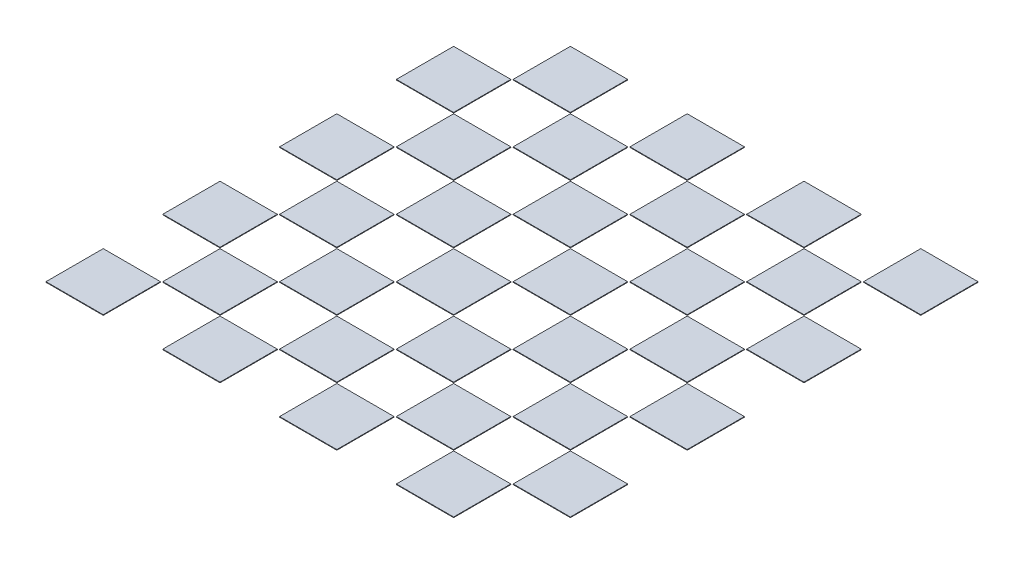
from build123d import *

# Parameters (mm, degrees)
SKETCH1_W                = 200
SKETCH1_H                = 200
BOSS_EXTRUDE1_DEPTH      = 3
SKETCH2_W                = 24.5625
SKETCH2_H                = 24.5625
CUT_EXTRUDE1_DEPTH       = 0.25
SKETCH4_W                = 4.4
SKETCH4_H                = 3.5
SKETCH4_W_2              = 3.9
SKETCH4_H_2              = 3
SKETCH4_W_3              = 1.95
SKETCH4_H_3              = 1.5
CUT_EXTRUDE2_DEPTH       = 1.5
CUT_EXTRUDE3_START       = -2.75
CUT_EXTRUDE3_OUTLINE_W   = 200
CUT_EXTRUDE3_OUTLINE_H   = 200
CUT_EXTRUDE3_DEPTH       = 2.75
CUT_EXTRUDE3_START_2     = -3
CUT_EXTRUDE3_2_OUTLINE_W = 24.5625
CUT_EXTRUDE3_2_OUTLINE_H = 24.5625
CUT_EXTRUDE3_2_DEPTH     = 0.25


# Read off the part's stored shape, not the designer's step: Cut-Extrude3
with BuildPart() as part:
    # Sketch1 → Boss-Extrude1 (new body)
    with BuildSketch(Plane(origin=(0, 0, 0), x_dir=(1, 0, 0), z_dir=(0, 1, 0))):
        with Locations((100, 100)):
            Rectangle(SKETCH1_W, SKETCH1_H)
    extrude(amount=BOSS_EXTRUDE1_DEPTH)

    # Sketch2 → Cut-Extrude1 (cut)
    with BuildSketch(Plane(origin=(0, 3, 0), x_dir=(1, 0, 0), z_dir=(0, 1, 0))):
        Polygon((150.375, 24.5625), (174.9375, 24.5625), (174.9375, 0), (175.4375, 0), (175.4375, 24.5625), (200, 24.5625), (200, 25.0625), (175.4375, 25.0625), (175.4375, 49.625), (200, 49.625), (200, 50.125), (175.4375, 50.125), (175.4375, 74.6875), (200, 74.6875), (200, 75.1875), (175.4375, 75.1875), (175.4375, 99.75), (200, 99.75), (200, 100.25), (175.4375, 100.25), (175.4375, 124.8125), (200, 124.8125), (200, 125.3125), (175.4375, 125.3125), (175.4375, 149.875), (200, 149.875), (200, 150.375), (175.4375, 150.375), (175.4375, 174.9375), (200, 174.9375), (200, 175.4375), (175.4375, 175.4375), (175.4375, 200), (174.9375, 200), (174.9375, 175.4375), (150.375, 175.4375), (150.375, 200), (149.875, 200), (149.875, 175.4375), (125.3125, 175.4375), (125.3125, 200), (124.8125, 200), (124.8125, 175.4375), (100.25, 175.4375), (100.25, 200), (99.75, 200), (99.75, 175.4375), (75.1875, 175.4375), (75.1875, 200), (74.6875, 200), (74.6875, 175.4375), (50.125, 175.4375), (50.125, 200), (49.625, 200), (49.625, 175.4375), (25.0625, 175.4375), (25.0625, 200), (24.5625, 200), (24.5625, 175.4375), (0, 175.4375), (0, 174.9375), (24.5625, 174.9375), (24.5625, 150.375), (0, 150.375), (0, 149.875), (24.5625, 149.875), (24.5625, 125.3125), (0, 125.3125), (0, 124.8125), (24.5625, 124.8125), (24.5625, 100.25), (0, 100.25), (0, 99.75), (24.5625, 99.75), (24.5625, 75.1875), (0, 75.1875), (0, 74.6875), (24.5625, 74.6875), (24.5625, 50.125), (0, 50.125), (0, 49.625), (24.5625, 49.625), (24.5625, 25.0625), (0, 25.0625), (0, 24.5625), (24.5625, 24.5625), (24.5625, 0), (25.0625, 0), (25.0625, 24.5625), (49.625, 24.5625), (49.625, 0), (50.125, 0), (50.125, 24.5625), (74.6875, 24.5625), (74.6875, 0), (75.1875, 0), (75.1875, 24.5625), (99.75, 24.5625), (99.75, 0), (100.25, 0), (100.25, 24.5625), (124.8125, 24.5625), (124.8125, 0), (125.3125, 0), (125.3125, 24.5625), (149.875, 24.5625), (149.875, 0), (150.375, 0), align=None)
        with Locations((37.34375, 37.34375)):
            Rectangle(SKETCH2_W, SKETCH2_H, mode=Mode.SUBTRACT)
        with Locations((62.40625, 37.34375)):
            Rectangle(SKETCH2_W, SKETCH2_H, mode=Mode.SUBTRACT)
        with Locations((37.34375, 62.40625)):
            Rectangle(SKETCH2_W, SKETCH2_H, mode=Mode.SUBTRACT)
        with Locations((62.40625, 62.40625)):
            Rectangle(SKETCH2_W, SKETCH2_H, mode=Mode.SUBTRACT)
        with Locations((87.46875, 37.34375)):
            Rectangle(SKETCH2_W, SKETCH2_H, mode=Mode.SUBTRACT)
        with Locations((87.46875, 62.40625)):
            Rectangle(SKETCH2_W, SKETCH2_H, mode=Mode.SUBTRACT)
        with Locations((37.34375, 87.46875)):
            Rectangle(SKETCH2_W, SKETCH2_H, mode=Mode.SUBTRACT)
        with Locations((62.40625, 87.46875)):
            Rectangle(SKETCH2_W, SKETCH2_H, mode=Mode.SUBTRACT)
        with Locations((87.46875, 87.46875)):
            Rectangle(SKETCH2_W, SKETCH2_H, mode=Mode.SUBTRACT)
        with Locations((112.53125, 37.34375)):
            Rectangle(SKETCH2_W, SKETCH2_H, mode=Mode.SUBTRACT)
        with Locations((112.53125, 62.40625)):
            Rectangle(SKETCH2_W, SKETCH2_H, mode=Mode.SUBTRACT)
        with Locations((137.59375, 37.34375)):
            Rectangle(SKETCH2_W, SKETCH2_H, mode=Mode.SUBTRACT)
        with Locations((162.65625, 37.34375)):
            Rectangle(SKETCH2_W, SKETCH2_H, mode=Mode.SUBTRACT)
        with Locations((137.59375, 62.40625)):
            Rectangle(SKETCH2_W, SKETCH2_H, mode=Mode.SUBTRACT)
        with Locations((162.65625, 62.40625)):
            Rectangle(SKETCH2_W, SKETCH2_H, mode=Mode.SUBTRACT)
        with Locations((112.53125, 87.46875)):
            Rectangle(SKETCH2_W, SKETCH2_H, mode=Mode.SUBTRACT)
        with Locations((137.59375, 87.46875)):
            Rectangle(SKETCH2_W, SKETCH2_H, mode=Mode.SUBTRACT)
        with Locations((162.65625, 87.46875)):
            Rectangle(SKETCH2_W, SKETCH2_H, mode=Mode.SUBTRACT)
        with Locations((37.34375, 112.53125)):
            Rectangle(SKETCH2_W, SKETCH2_H, mode=Mode.SUBTRACT)
        with Locations((62.40625, 112.53125)):
            Rectangle(SKETCH2_W, SKETCH2_H, mode=Mode.SUBTRACT)
        with Locations((87.46875, 112.53125)):
            Rectangle(SKETCH2_W, SKETCH2_H, mode=Mode.SUBTRACT)
        with Locations((37.34375, 137.59375)):
            Rectangle(SKETCH2_W, SKETCH2_H, mode=Mode.SUBTRACT)
        with Locations((62.40625, 137.59375)):
            Rectangle(SKETCH2_W, SKETCH2_H, mode=Mode.SUBTRACT)
        with Locations((37.34375, 162.65625)):
            Rectangle(SKETCH2_W, SKETCH2_H, mode=Mode.SUBTRACT)
        with Locations((62.40625, 162.65625)):
            Rectangle(SKETCH2_W, SKETCH2_H, mode=Mode.SUBTRACT)
        with Locations((87.46875, 137.59375)):
            Rectangle(SKETCH2_W, SKETCH2_H, mode=Mode.SUBTRACT)
        with Locations((87.46875, 162.65625)):
            Rectangle(SKETCH2_W, SKETCH2_H, mode=Mode.SUBTRACT)
        with Locations((112.53125, 112.53125)):
            Rectangle(SKETCH2_W, SKETCH2_H, mode=Mode.SUBTRACT)
        with Locations((137.59375, 112.53125)):
            Rectangle(SKETCH2_W, SKETCH2_H, mode=Mode.SUBTRACT)
        with Locations((162.65625, 112.53125)):
            Rectangle(SKETCH2_W, SKETCH2_H, mode=Mode.SUBTRACT)
        with Locations((112.53125, 137.59375)):
            Rectangle(SKETCH2_W, SKETCH2_H, mode=Mode.SUBTRACT)
        with Locations((112.53125, 162.65625)):
            Rectangle(SKETCH2_W, SKETCH2_H, mode=Mode.SUBTRACT)
        with Locations((137.59375, 137.59375)):
            Rectangle(SKETCH2_W, SKETCH2_H, mode=Mode.SUBTRACT)
        with Locations((162.65625, 137.59375)):
            Rectangle(SKETCH2_W, SKETCH2_H, mode=Mode.SUBTRACT)
        with Locations((137.59375, 162.65625)):
            Rectangle(SKETCH2_W, SKETCH2_H, mode=Mode.SUBTRACT)
        with Locations((162.65625, 162.65625)):
            Rectangle(SKETCH2_W, SKETCH2_H, mode=Mode.SUBTRACT)
    extrude(amount=-CUT_EXTRUDE1_DEPTH, mode=Mode.SUBTRACT)

    # Sketch4 → Cut-Extrude2 (cut)
    # profile 1 of 68: a face of its own
    with BuildSketch(Plane.XZ):
        with Locations((37.3425, -162.6575)):
            Rectangle(SKETCH4_W, SKETCH4_H)
    # profile 2 of 68: a face of its own
    with BuildSketch(Plane.XZ):
        with Locations((12.28, -162.6575)):
            Rectangle(SKETCH4_W, SKETCH4_H)
    # profile 3 of 68: a face of its own
    with BuildSketch(Plane.XZ):
        with Locations((12.28, -187.72)):
            Rectangle(SKETCH4_W, SKETCH4_H)
        with Locations((12.28, -187.72)):
            Rectangle(SKETCH4_W_2, SKETCH4_H_2, mode=Mode.SUBTRACT)
    # profile 4 of 68: a face of its own
    with BuildSketch(Plane.XZ):
        with Locations((13.255, -188.47)):
            Rectangle(SKETCH4_W_3, SKETCH4_H_3)
    # profile 5 of 68: a face of its own
    with BuildSketch(Plane.XZ):
        with Locations((13.255, -186.97)):
            Rectangle(SKETCH4_W_3, SKETCH4_H_3)
    # profile 6 of 68: a face of its own
    with BuildSketch(Plane.XZ):
        with Locations((11.305, -186.97)):
            Rectangle(SKETCH4_W_3, SKETCH4_H_3)
    # profile 7 of 68: a face of its own
    with BuildSketch(Plane.XZ):
        with Locations((11.305, -188.47)):
            Rectangle(SKETCH4_W_3, SKETCH4_H_3)
    # profile 8 of 68: a face of its own
    with BuildSketch(Plane.XZ):
        with Locations((37.3425, -187.72)):
            Rectangle(SKETCH4_W, SKETCH4_H)
    # profile 9 of 68: a face of its own
    with BuildSketch(Plane.XZ):
        with Locations((62.405, -187.72)):
            Rectangle(SKETCH4_W, SKETCH4_H)
    # profile 10 of 68: a face of its own
    with BuildSketch(Plane.XZ):
        with Locations((87.4675, -187.72)):
            Rectangle(SKETCH4_W, SKETCH4_H)
    # profile 11 of 68: a face of its own
    with BuildSketch(Plane.XZ):
        with Locations((112.53, -187.72)):
            Rectangle(SKETCH4_W, SKETCH4_H)
    # profile 12 of 68: a face of its own
    with BuildSketch(Plane.XZ):
        with Locations((137.5925, -187.72)):
            Rectangle(SKETCH4_W, SKETCH4_H)
    # profile 13 of 68: a face of its own
    with BuildSketch(Plane.XZ):
        with Locations((162.655, -187.72)):
            Rectangle(SKETCH4_W, SKETCH4_H)
    # profile 14 of 68: a face of its own
    with BuildSketch(Plane.XZ):
        with Locations((187.7175, -187.72)):
            Rectangle(SKETCH4_W, SKETCH4_H)
    # profile 15 of 68: a face of its own
    with BuildSketch(Plane.XZ):
        with Locations((187.7175, -162.6575)):
            Rectangle(SKETCH4_W, SKETCH4_H)
    # profile 16 of 68: a face of its own
    with BuildSketch(Plane.XZ):
        with Locations((162.655, -162.6575)):
            Rectangle(SKETCH4_W, SKETCH4_H)
    # profile 17 of 68: a face of its own
    with BuildSketch(Plane.XZ):
        with Locations((137.5925, -162.6575)):
            Rectangle(SKETCH4_W, SKETCH4_H)
    # profile 18 of 68: a face of its own
    with BuildSketch(Plane.XZ):
        with Locations((112.53, -162.6575)):
            Rectangle(SKETCH4_W, SKETCH4_H)
    # profile 19 of 68: a face of its own
    with BuildSketch(Plane.XZ):
        with Locations((87.4675, -162.6575)):
            Rectangle(SKETCH4_W, SKETCH4_H)
    # profile 20 of 68: a face of its own
    with BuildSketch(Plane.XZ):
        with Locations((62.405, -162.6575)):
            Rectangle(SKETCH4_W, SKETCH4_H)
    # profile 21 of 68: a face of its own
    with BuildSketch(Plane.XZ):
        with Locations((12.28, -137.595)):
            Rectangle(SKETCH4_W, SKETCH4_H)
    # profile 22 of 68: a face of its own
    with BuildSketch(Plane.XZ):
        with Locations((37.3425, -137.595)):
            Rectangle(SKETCH4_W, SKETCH4_H)
    # profile 23 of 68: a face of its own
    with BuildSketch(Plane.XZ):
        with Locations((62.405, -137.595)):
            Rectangle(SKETCH4_W, SKETCH4_H)
    # profile 24 of 68: a face of its own
    with BuildSketch(Plane.XZ):
        with Locations((87.4675, -137.595)):
            Rectangle(SKETCH4_W, SKETCH4_H)
    # profile 25 of 68: a face of its own
    with BuildSketch(Plane.XZ):
        with Locations((112.53, -137.595)):
            Rectangle(SKETCH4_W, SKETCH4_H)
    # profile 26 of 68: a face of its own
    with BuildSketch(Plane.XZ):
        with Locations((137.5925, -137.595)):
            Rectangle(SKETCH4_W, SKETCH4_H)
    # profile 27 of 68: a face of its own
    with BuildSketch(Plane.XZ):
        with Locations((162.655, -137.595)):
            Rectangle(SKETCH4_W, SKETCH4_H)
    # profile 28 of 68: a face of its own
    with BuildSketch(Plane.XZ):
        with Locations((187.7175, -137.595)):
            Rectangle(SKETCH4_W, SKETCH4_H)
    # profile 29 of 68: a face of its own
    with BuildSketch(Plane.XZ):
        with Locations((187.7175, -112.5325)):
            Rectangle(SKETCH4_W, SKETCH4_H)
    # profile 30 of 68: a face of its own
    with BuildSketch(Plane.XZ):
        with Locations((162.655, -112.5325)):
            Rectangle(SKETCH4_W, SKETCH4_H)
    # profile 31 of 68: a face of its own
    with BuildSketch(Plane.XZ):
        with Locations((137.5925, -112.5325)):
            Rectangle(SKETCH4_W, SKETCH4_H)
    # profile 32 of 68: a face of its own
    with BuildSketch(Plane.XZ):
        with Locations((112.53, -112.5325)):
            Rectangle(SKETCH4_W, SKETCH4_H)
    # profile 33 of 68: a face of its own
    with BuildSketch(Plane.XZ):
        with Locations((87.4675, -112.5325)):
            Rectangle(SKETCH4_W, SKETCH4_H)
    # profile 34 of 68: a face of its own
    with BuildSketch(Plane.XZ):
        with Locations((62.405, -112.5325)):
            Rectangle(SKETCH4_W, SKETCH4_H)
    # profile 35 of 68: a face of its own
    with BuildSketch(Plane.XZ):
        with Locations((37.3425, -112.5325)):
            Rectangle(SKETCH4_W, SKETCH4_H)
    # profile 36 of 68: a face of its own
    with BuildSketch(Plane.XZ):
        with Locations((12.28, -112.5325)):
            Rectangle(SKETCH4_W, SKETCH4_H)
    # profile 37 of 68: a face of its own
    with BuildSketch(Plane.XZ):
        with Locations((12.28, -87.47)):
            Rectangle(SKETCH4_W, SKETCH4_H)
    # profile 38 of 68: a face of its own
    with BuildSketch(Plane.XZ):
        with Locations((37.3425, -87.47)):
            Rectangle(SKETCH4_W, SKETCH4_H)
    # profile 39 of 68: a face of its own
    with BuildSketch(Plane.XZ):
        with Locations((62.405, -87.47)):
            Rectangle(SKETCH4_W, SKETCH4_H)
    # profile 40 of 68: a face of its own
    with BuildSketch(Plane.XZ):
        with Locations((87.4675, -87.47)):
            Rectangle(SKETCH4_W, SKETCH4_H)
    # profile 41 of 68: a face of its own
    with BuildSketch(Plane.XZ):
        with Locations((112.53, -87.47)):
            Rectangle(SKETCH4_W, SKETCH4_H)
    # profile 42 of 68: a face of its own
    with BuildSketch(Plane.XZ):
        with Locations((137.5925, -87.47)):
            Rectangle(SKETCH4_W, SKETCH4_H)
    # profile 43 of 68: a face of its own
    with BuildSketch(Plane.XZ):
        with Locations((162.655, -87.47)):
            Rectangle(SKETCH4_W, SKETCH4_H)
    # profile 44 of 68: a face of its own
    with BuildSketch(Plane.XZ):
        with Locations((187.7175, -87.47)):
            Rectangle(SKETCH4_W, SKETCH4_H)
    # profile 45 of 68: a face of its own
    with BuildSketch(Plane.XZ):
        with Locations((187.7175, -62.4075)):
            Rectangle(SKETCH4_W, SKETCH4_H)
    # profile 46 of 68: a face of its own
    with BuildSketch(Plane.XZ):
        with Locations((162.655, -62.4075)):
            Rectangle(SKETCH4_W, SKETCH4_H)
    # profile 47 of 68: a face of its own
    with BuildSketch(Plane.XZ):
        with Locations((137.5925, -62.4075)):
            Rectangle(SKETCH4_W, SKETCH4_H)
    # profile 48 of 68: a face of its own
    with BuildSketch(Plane.XZ):
        with Locations((112.53, -62.4075)):
            Rectangle(SKETCH4_W, SKETCH4_H)
    # profile 49 of 68: a face of its own
    with BuildSketch(Plane.XZ):
        with Locations((87.4675, -62.4075)):
            Rectangle(SKETCH4_W, SKETCH4_H)
    # profile 50 of 68: a face of its own
    with BuildSketch(Plane.XZ):
        with Locations((62.405, -62.4075)):
            Rectangle(SKETCH4_W, SKETCH4_H)
    # profile 51 of 68: a face of its own
    with BuildSketch(Plane.XZ):
        with Locations((37.3425, -62.4075)):
            Rectangle(SKETCH4_W, SKETCH4_H)
    # profile 52 of 68: a face of its own
    with BuildSketch(Plane.XZ):
        with Locations((12.28, -62.4075)):
            Rectangle(SKETCH4_W, SKETCH4_H)
    # profile 53 of 68: a face of its own
    with BuildSketch(Plane.XZ):
        with Locations((12.28, -37.345)):
            Rectangle(SKETCH4_W, SKETCH4_H)
    # profile 54 of 68: a face of its own
    with BuildSketch(Plane.XZ):
        with Locations((37.3425, -37.345)):
            Rectangle(SKETCH4_W, SKETCH4_H)
    # profile 55 of 68: a face of its own
    with BuildSketch(Plane.XZ):
        with Locations((62.405, -37.345)):
            Rectangle(SKETCH4_W, SKETCH4_H)
    # profile 56 of 68: a face of its own
    with BuildSketch(Plane.XZ):
        with Locations((87.4675, -37.345)):
            Rectangle(SKETCH4_W, SKETCH4_H)
    # profile 57 of 68: a face of its own
    with BuildSketch(Plane.XZ):
        with Locations((112.53, -37.345)):
            Rectangle(SKETCH4_W, SKETCH4_H)
    # profile 58 of 68: a face of its own
    with BuildSketch(Plane.XZ):
        with Locations((137.5925, -37.345)):
            Rectangle(SKETCH4_W, SKETCH4_H)
    # profile 59 of 68: a face of its own
    with BuildSketch(Plane.XZ):
        with Locations((162.655, -37.345)):
            Rectangle(SKETCH4_W, SKETCH4_H)
    # profile 60 of 68: a face of its own
    with BuildSketch(Plane.XZ):
        with Locations((187.7175, -37.345)):
            Rectangle(SKETCH4_W, SKETCH4_H)
    # profile 61 of 68: a face of its own
    with BuildSketch(Plane.XZ):
        with Locations((187.7175, -12.2825)):
            Rectangle(SKETCH4_W, SKETCH4_H)
    # profile 62 of 68: a face of its own
    with BuildSketch(Plane.XZ):
        with Locations((162.655, -12.2825)):
            Rectangle(SKETCH4_W, SKETCH4_H)
    # profile 63 of 68: a face of its own
    with BuildSketch(Plane.XZ):
        with Locations((137.5925, -12.2825)):
            Rectangle(SKETCH4_W, SKETCH4_H)
    # profile 64 of 68: a face of its own
    with BuildSketch(Plane.XZ):
        with Locations((112.53, -12.2825)):
            Rectangle(SKETCH4_W, SKETCH4_H)
    # profile 65 of 68: a face of its own
    with BuildSketch(Plane.XZ):
        with Locations((87.4675, -12.2825)):
            Rectangle(SKETCH4_W, SKETCH4_H)
    # profile 66 of 68: a face of its own
    with BuildSketch(Plane.XZ):
        with Locations((62.405, -12.2825)):
            Rectangle(SKETCH4_W, SKETCH4_H)
    # profile 67 of 68: a face of its own
    with BuildSketch(Plane.XZ):
        with Locations((12.28, -12.2825)):
            Rectangle(SKETCH4_W, SKETCH4_H)
    # profile 68 of 68: a face of its own
    with BuildSketch(Plane.XZ):
        with Locations((37.3425, -12.2825)):
            Rectangle(SKETCH4_W, SKETCH4_H)
    extrude(amount=-CUT_EXTRUDE2_DEPTH, mode=Mode.SUBTRACT)

    # Cut-Extrude3 outline → Cut-Extrude3 (cut)
    with BuildSketch(Plane.XZ.offset(CUT_EXTRUDE3_START)):
        with Locations((100, -100)):
            Rectangle(CUT_EXTRUDE3_OUTLINE_W, CUT_EXTRUDE3_OUTLINE_H)
    extrude(amount=CUT_EXTRUDE3_DEPTH, mode=Mode.SUBTRACT)

    # Cut-Extrude3 2 outline → Cut-Extrude3 2 (cut)
    with BuildSketch(Plane.XZ.offset(CUT_EXTRUDE3_START_2)):
        with Locations((12.28125, -187.71875)):
            Rectangle(CUT_EXTRUDE3_2_OUTLINE_W, CUT_EXTRUDE3_2_OUTLINE_H)
        with Locations((12.28125, -137.59375)):
            Rectangle(CUT_EXTRUDE3_2_OUTLINE_W, CUT_EXTRUDE3_2_OUTLINE_H)
        with Locations((62.40625, -187.71875)):
            Rectangle(CUT_EXTRUDE3_2_OUTLINE_W, CUT_EXTRUDE3_2_OUTLINE_H)
        with Locations((12.28125, -87.46875)):
            Rectangle(CUT_EXTRUDE3_2_OUTLINE_W, CUT_EXTRUDE3_2_OUTLINE_H)
        with Locations((112.53125, -187.71875)):
            Rectangle(CUT_EXTRUDE3_2_OUTLINE_W, CUT_EXTRUDE3_2_OUTLINE_H)
        with Locations((12.28125, -37.34375)):
            Rectangle(CUT_EXTRUDE3_2_OUTLINE_W, CUT_EXTRUDE3_2_OUTLINE_H)
        with Locations((162.65625, -187.71875)):
            Rectangle(CUT_EXTRUDE3_2_OUTLINE_W, CUT_EXTRUDE3_2_OUTLINE_H)
        with Locations((37.34375, -12.28125)):
            Rectangle(CUT_EXTRUDE3_2_OUTLINE_W, CUT_EXTRUDE3_2_OUTLINE_H)
        with Locations((187.71875, -162.65625)):
            Rectangle(CUT_EXTRUDE3_2_OUTLINE_W, CUT_EXTRUDE3_2_OUTLINE_H)
        with Locations((87.46875, -12.28125)):
            Rectangle(CUT_EXTRUDE3_2_OUTLINE_W, CUT_EXTRUDE3_2_OUTLINE_H)
        with Locations((187.71875, -112.53125)):
            Rectangle(CUT_EXTRUDE3_2_OUTLINE_W, CUT_EXTRUDE3_2_OUTLINE_H)
        with Locations((137.59375, -12.28125)):
            Rectangle(CUT_EXTRUDE3_2_OUTLINE_W, CUT_EXTRUDE3_2_OUTLINE_H)
        with Locations((187.71875, -62.40625)):
            Rectangle(CUT_EXTRUDE3_2_OUTLINE_W, CUT_EXTRUDE3_2_OUTLINE_H)
        with Locations((187.71875, -12.28125)):
            Rectangle(CUT_EXTRUDE3_2_OUTLINE_W, CUT_EXTRUDE3_2_OUTLINE_H)
        with Locations((62.40625, -87.46875)):
            Rectangle(CUT_EXTRUDE3_2_OUTLINE_W, CUT_EXTRUDE3_2_OUTLINE_H)
        with Locations((112.53125, -87.46875)):
            Rectangle(CUT_EXTRUDE3_2_OUTLINE_W, CUT_EXTRUDE3_2_OUTLINE_H)
        with Locations((162.65625, -87.46875)):
            Rectangle(CUT_EXTRUDE3_2_OUTLINE_W, CUT_EXTRUDE3_2_OUTLINE_H)
        with Locations((37.34375, -62.40625)):
            Rectangle(CUT_EXTRUDE3_2_OUTLINE_W, CUT_EXTRUDE3_2_OUTLINE_H)
        with Locations((87.46875, -62.40625)):
            Rectangle(CUT_EXTRUDE3_2_OUTLINE_W, CUT_EXTRUDE3_2_OUTLINE_H)
        with Locations((137.59375, -62.40625)):
            Rectangle(CUT_EXTRUDE3_2_OUTLINE_W, CUT_EXTRUDE3_2_OUTLINE_H)
        with Locations((62.40625, -37.34375)):
            Rectangle(CUT_EXTRUDE3_2_OUTLINE_W, CUT_EXTRUDE3_2_OUTLINE_H)
        with Locations((112.53125, -37.34375)):
            Rectangle(CUT_EXTRUDE3_2_OUTLINE_W, CUT_EXTRUDE3_2_OUTLINE_H)
        with Locations((162.65625, -37.34375)):
            Rectangle(CUT_EXTRUDE3_2_OUTLINE_W, CUT_EXTRUDE3_2_OUTLINE_H)
        with Locations((37.34375, -162.65625)):
            Rectangle(CUT_EXTRUDE3_2_OUTLINE_W, CUT_EXTRUDE3_2_OUTLINE_H)
        with Locations((87.46875, -162.65625)):
            Rectangle(CUT_EXTRUDE3_2_OUTLINE_W, CUT_EXTRUDE3_2_OUTLINE_H)
        with Locations((137.59375, -162.65625)):
            Rectangle(CUT_EXTRUDE3_2_OUTLINE_W, CUT_EXTRUDE3_2_OUTLINE_H)
        with Locations((62.40625, -137.59375)):
            Rectangle(CUT_EXTRUDE3_2_OUTLINE_W, CUT_EXTRUDE3_2_OUTLINE_H)
        with Locations((112.53125, -137.59375)):
            Rectangle(CUT_EXTRUDE3_2_OUTLINE_W, CUT_EXTRUDE3_2_OUTLINE_H)
        with Locations((162.65625, -137.59375)):
            Rectangle(CUT_EXTRUDE3_2_OUTLINE_W, CUT_EXTRUDE3_2_OUTLINE_H)
        with Locations((37.34375, -112.53125)):
            Rectangle(CUT_EXTRUDE3_2_OUTLINE_W, CUT_EXTRUDE3_2_OUTLINE_H)
        with Locations((87.46875, -112.53125)):
            Rectangle(CUT_EXTRUDE3_2_OUTLINE_W, CUT_EXTRUDE3_2_OUTLINE_H)
        with Locations((137.59375, -112.53125)):
            Rectangle(CUT_EXTRUDE3_2_OUTLINE_W, CUT_EXTRUDE3_2_OUTLINE_H)
    extrude(amount=CUT_EXTRUDE3_2_DEPTH, mode=Mode.SUBTRACT)


solid = part.part
